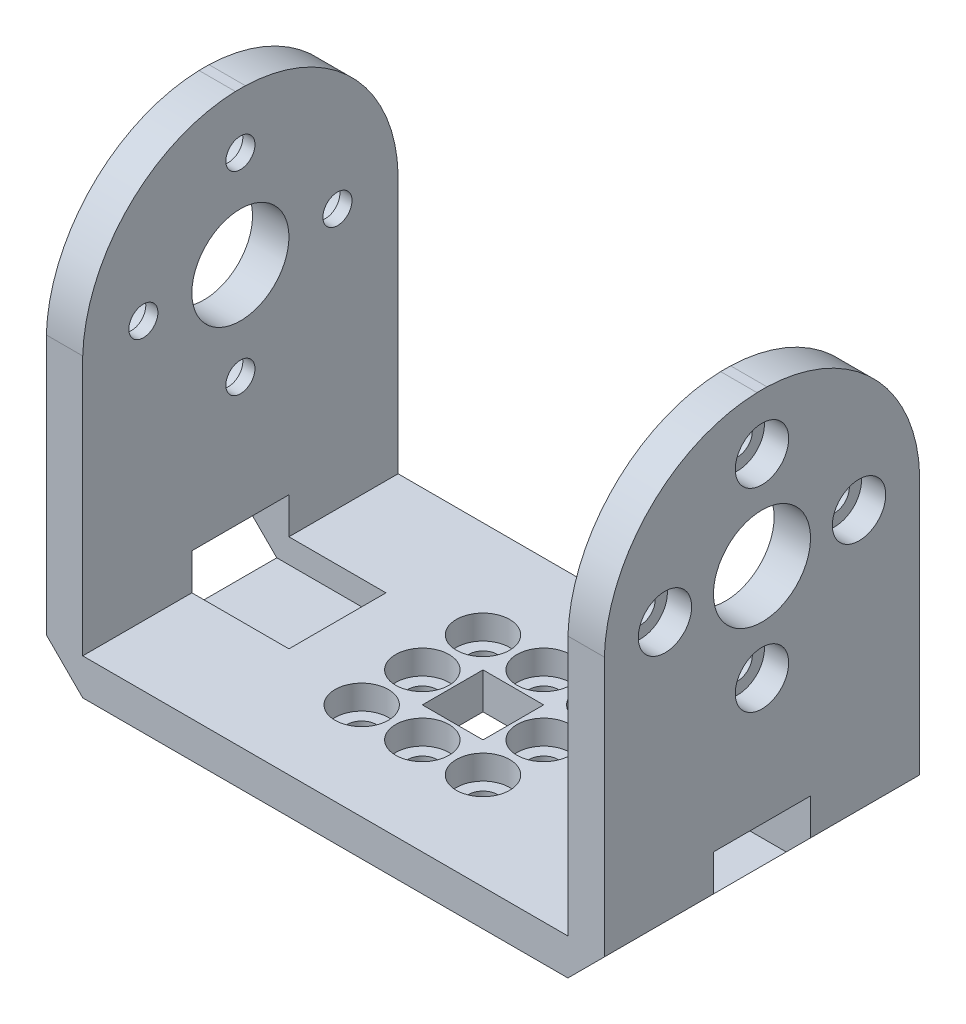
from build123d import *

# Parameters (mm, degrees)
SKETCH_1_W                   = 46
SKETCH_1_H                   = 26
EXTRUDE_1_DEPTH              = 3
SKETCH_2_W                   = 3
SKETCH_2_H                   = 26
EXTRUDE_2_DEPTH              = 34
CUT_EXTRUDE_START            = -46
CUT_EXTRUDE_1_DEPTH          = 46
SKETCH_4_R                   = 4
CUT_EXTRUDE_2_DEPTH          = 61.448325039
HOLE_START                   = -23
HOLE_WIZARD_M2_2_OUTLINE_R   = 2.2
HOLE_WIZARD_M2_2_DEPTH       = 2
HOLE_START_2                 = -21
HOLE_WIZARD_M2_2_2_OUTLINE_R = 1.2
HOLE_WIZARD_M2_2_2_DEPTH     = 1
CHAMFER_1_SIZE               = 3
SKETCH_15_W                  = 8
SKETCH_15_H                  = 5
CUT_EXTRUDE_8_DEPTH          = 11
CUT_EXTRUDE_9_DEPTH          = 44.058100283
CUT_EXTRUDE_9_DEPTH_BACK     = 44.058100283
SKETCH_18_W                  = 5
SKETCH_18_H                  = 5
HOLE_WIZARD_M2_4_D           = 2.4
HOLE_WIZARD_M2_4_CBORE_D     = 4.4
HOLE_WIZARD_M2_4_CBORE_DEPTH = 2


# Read off the part's stored shape, not the designer's step: 切除-拉伸1, M2 凹头盖螺钉的柱形沉头孔2
with BuildPart() as part:
    # 草图1 → 凸台-拉伸1 (new body)
    with BuildSketch(Plane(origin=(0, 0, 0), x_dir=(1, 0, 0), z_dir=(0, 1, 0))):
        Rectangle(SKETCH_1_W, SKETCH_1_H)
    extrude(amount=EXTRUDE_1_DEPTH)

    # 草图2 → 凸台-拉伸2 (add)
    with BuildSketch(Plane(origin=(0, 3, 0), x_dir=(1, 0, 0), z_dir=(0, 1, 0))):
        with Locations((-21.5, 0)):
            Rectangle(SKETCH_2_W, SKETCH_2_H)
        with Locations((21.5, 0)):
            Rectangle(SKETCH_2_W, SKETCH_2_H)
    extrude(amount=EXTRUDE_2_DEPTH)

    # 切除-拉伸1 outline → 切除-拉伸1 (cut)
    with BuildSketch(Plane.ZY.offset(23).offset(CUT_EXTRUDE_START)):
        with BuildLine():
            Line((13, 37), (0.412804961, 37))
            ThreePointArc((0.412804961, 37), (9.197021473, 33.197021473), (13, 24.412804961))
            Line((13, 24.412804961), (13, 37))
        make_face()
        with BuildLine():
            ThreePointArc((-13, 24.412804961), (-9.197021473, 33.197021473), (-0.412804961, 37))
            Line((-0.412804961, 37), (-13, 37))
            Line((-13, 37), (-13, 24.412804961))
        make_face()
    extrude(amount=CUT_EXTRUDE_1_DEPTH, mode=Mode.SUBTRACT)

    # 草图4 → 切除-拉伸2 (cut, through all)
    with BuildSketch(Plane.ZY.offset(23)):
        with Locations((0, 24.412804961)):
            Circle(SKETCH_4_R)
    extrude(amount=-CUT_EXTRUDE_2_DEPTH, mode=Mode.SUBTRACT)

    # M2 凹头盖螺钉的柱形沉头孔2 outline → M2 凹头盖螺钉的柱形沉头孔2 (cut)
    with BuildSketch(Plane.YZ.offset(HOLE_START)):
        with Locations((16.412804961, 0)):
            Circle(HOLE_WIZARD_M2_2_OUTLINE_R)
        with Locations((24.412804961, 8)):
            Circle(HOLE_WIZARD_M2_2_OUTLINE_R)
        with Locations((24.412804961, -8)):
            Circle(HOLE_WIZARD_M2_2_OUTLINE_R)
        with Locations((32.412804961, 0)):
            Circle(HOLE_WIZARD_M2_2_OUTLINE_R)
    hole_wizard_m2_2 = extrude(amount=HOLE_WIZARD_M2_2_DEPTH, mode=Mode.SUBTRACT)

    # Hole Wizard M2 _2 2 outline → Hole Wizard M2 _2 2 (cut)
    with BuildSketch(Plane.YZ.offset(HOLE_START_2)):
        with Locations((16.412804961, 0)):
            Circle(HOLE_WIZARD_M2_2_2_OUTLINE_R)
        with Locations((24.412804961, 8)):
            Circle(HOLE_WIZARD_M2_2_2_OUTLINE_R)
        with Locations((24.412804961, -8)):
            Circle(HOLE_WIZARD_M2_2_2_OUTLINE_R)
        with Locations((32.412804961, 0)):
            Circle(HOLE_WIZARD_M2_2_2_OUTLINE_R)
    hole_wizard_m2_2_2 = extrude(amount=HOLE_WIZARD_M2_2_2_DEPTH, mode=Mode.SUBTRACT)

    # 镜向2: M2 凹头盖螺钉的柱形沉头孔2, Hole Wizard M2 _2 2 across plane
    add(hole_wizard_m2_2.mirror(Plane(origin=(0, 0, 0), x_dir=(0, 0, 1), z_dir=(1, 0, 0))), mode=Mode.SUBTRACT)
    add(hole_wizard_m2_2_2.mirror(Plane(origin=(0, 0, 0), x_dir=(0, 0, 1), z_dir=(1, 0, 0))), mode=Mode.SUBTRACT)

    # 倒角1
    chamfer_1_edges = [part.edges().sort_by_distance(p)[0] for p in [
        (-23, 0, 0),
        (23, 0, 0),
    ]]
    chamfer(chamfer_1_edges, length=CHAMFER_1_SIZE)

    # 草图15 → 切除-拉伸8 (cut)
    with BuildSketch(Plane(origin=(23, 0, 0), x_dir=(0, 0, -1), z_dir=(1, 0, 0))):
        with Locations((0, 3.5)):
            Rectangle(SKETCH_15_W, SKETCH_15_H)
    cut_extrude_8 = extrude(amount=-CUT_EXTRUDE_8_DEPTH, mode=Mode.SUBTRACT)

    # 镜向3: 切除-拉伸8 across plane
    add(cut_extrude_8.mirror(Plane(origin=(0, 0, 0), x_dir=(0, 0, 1), z_dir=(1, 0, 0))), mode=Mode.SUBTRACT)

    # 草图18 → 切除-拉伸9 (cut, two sides: drawn at the far end of the back side and taken through both)
    with BuildSketch(Plane(origin=(0, 3, 0), x_dir=(1, 0, 0), z_dir=(0, 1, 0)).offset(-CUT_EXTRUDE_9_DEPTH_BACK)):
        Rectangle(SKETCH_18_W, SKETCH_18_H)
    extrude(amount=CUT_EXTRUDE_9_DEPTH + CUT_EXTRUDE_9_DEPTH_BACK, mode=Mode.SUBTRACT)

    # M2 凹头盖螺钉的柱形沉头孔4 (through all)
    with Locations(Plane(origin=(-5, 3, -5), x_dir=(0, 0, 1), z_dir=(0, 1, 0))):
        with Locations((0, 0), (5, 0), (10, 0), (10, 5), (10, 10), (5, 10), (0, 10), (0, 5)):
            CounterBoreHole(HOLE_WIZARD_M2_4_D / 2, HOLE_WIZARD_M2_4_CBORE_D / 2, HOLE_WIZARD_M2_4_CBORE_DEPTH)


solid = part.part
